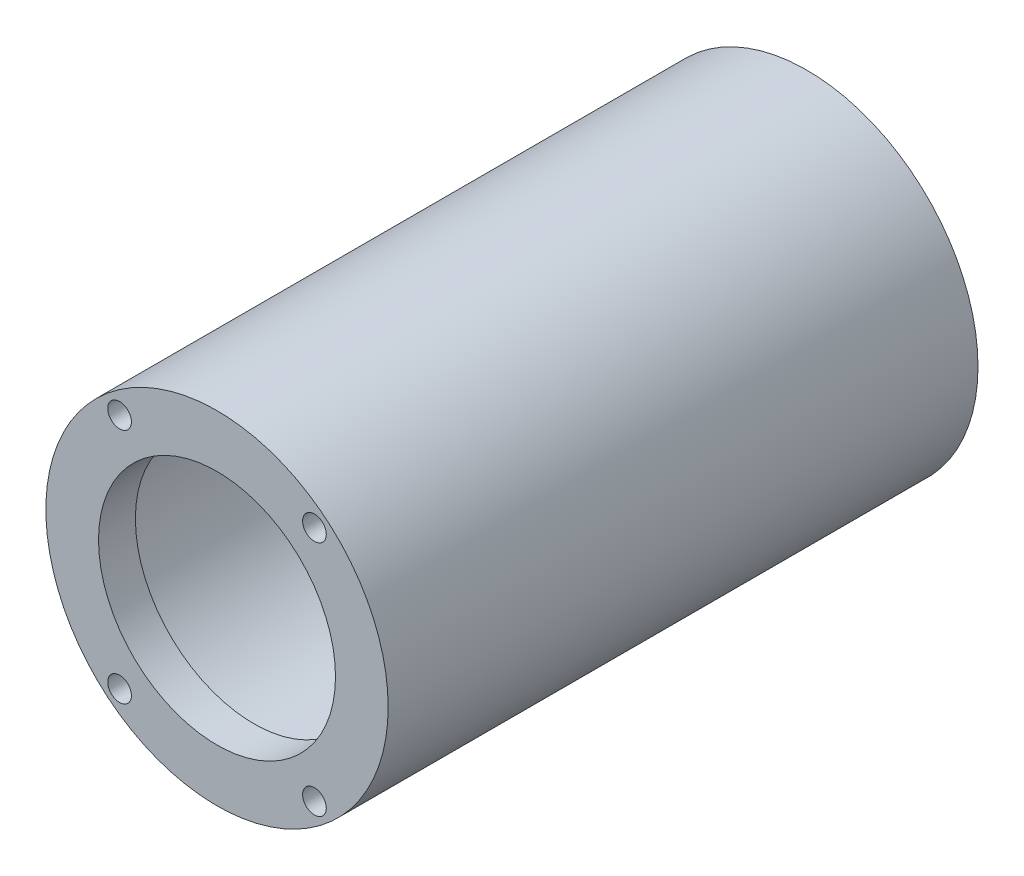
from build123d import *

# Parameters (mm, degrees)
CROQUIS1_R          = 32.5
CROQUIS1_R_2        = 27.5
BOSS_EXTRUDE1_DEPTH = 112
SKETCH1_R           = 1.5
CUT_EXTRUDE1_DEPTH  = 5
BOSS_EXTRUDE3_START = -7
SKETCH3_R           = 27.5
SKETCH3_R_2         = 22.5
BOSS_EXTRUDE3_DEPTH = 7
SKETCH2_R           = 2.25
CUT_EXTRUDE2_DEPTH  = 5


with BuildPart() as part:
    # Croquis1 → Boss-Extrude1 (new body)
    with BuildSketch(Plane.XY):
        Circle(CROQUIS1_R)
        Circle(CROQUIS1_R_2, mode=Mode.SUBTRACT)
    extrude(amount=BOSS_EXTRUDE1_DEPTH)

    # Sketch1 → Cut-Extrude1 (cut)
    with BuildSketch(Plane(origin=(0, 0, 0), x_dir=(-1, 0, 0), z_dir=(0, 0, -1))):
        with Locations((-30, 0)):
            Circle(SKETCH1_R)
        with Locations((0, 30)):
            Circle(SKETCH1_R)
        with Locations((30, 0)):
            Circle(SKETCH1_R)
        with Locations((0, -30)):
            Circle(SKETCH1_R)
    extrude(amount=-CUT_EXTRUDE1_DEPTH, mode=Mode.SUBTRACT)

    # Sketch3 → Boss-Extrude3 (add)
    with BuildSketch(Plane.XY.offset(112).offset(BOSS_EXTRUDE3_START)):
        Circle(SKETCH3_R)
        Circle(SKETCH3_R_2, mode=Mode.SUBTRACT)
    extrude(amount=BOSS_EXTRUDE3_DEPTH)

    # Sketch2 → Cut-Extrude2 (cut)
    with BuildSketch(Plane.XY.offset(112)):
        with Locations((-18.5, 22.5)):
            Circle(SKETCH2_R)
        with Locations((18.5, 22.5)):
            Circle(SKETCH2_R)
        with Locations((18.5, -22.5)):
            Circle(SKETCH2_R)
        with Locations((-18.5, -22.5)):
            Circle(SKETCH2_R)
    extrude(amount=-CUT_EXTRUDE2_DEPTH, mode=Mode.SUBTRACT)


solid = part.part
